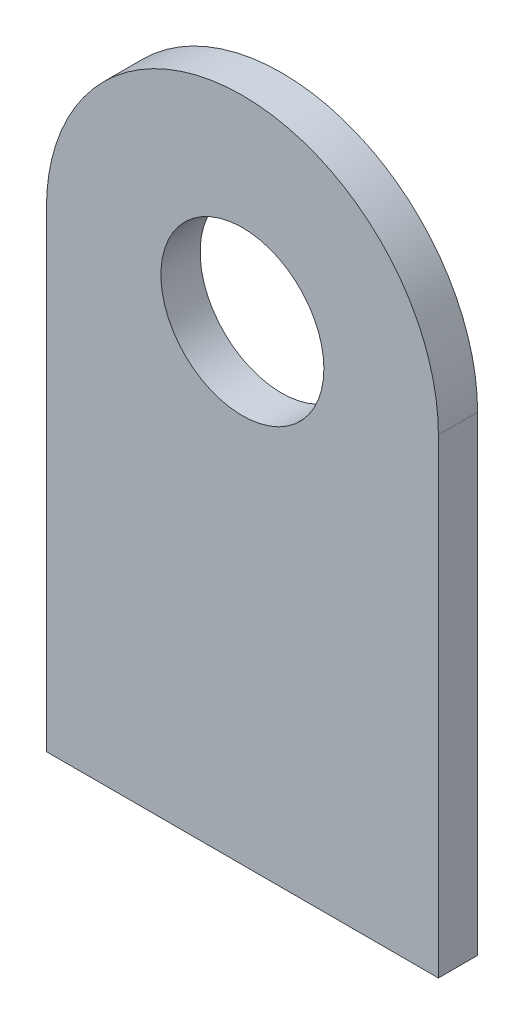
from build123d import *

# Parameters (mm, degrees)
BOSS_EXTRUDE1_DEPTH  = 1.5875
M6_CLEARANCE_HOLE1_D = 6.6
SKETCH5_W            = 15.875
SKETCH5_H            = 6.35
CUT_EXTRUDE2_DEPTH   = 27.658658303


with BuildPart() as part:
    # Sketch1 → Boss-Extrude1 (new body)
    with BuildSketch(Plane.XY):
        with BuildLine():
            Line((7.9375, -25.4), (7.9375, 0))
            ThreePointArc((7.9375, 0), (0, 7.9375), (-7.9375, 0))
            Line((-7.9375, 0), (-7.9375, -25.4))
            Line((-7.9375, -25.4), (7.9375, -25.4))
        make_face()
    extrude(amount=BOSS_EXTRUDE1_DEPTH)

    # M6 Clearance Hole1 (through all)
    with Locations(Plane.XY.offset(1.5875)):
        with Locations((0, 0)):
            Hole(M6_CLEARANCE_HOLE1_D / 2)

    # Sketch5 → Cut-Extrude2 (cut, through all)
    with BuildSketch(Plane.XY.offset(1.5875)):
        with Locations((0, -22.225)):
            Rectangle(SKETCH5_W, SKETCH5_H)
    extrude(amount=-CUT_EXTRUDE2_DEPTH, mode=Mode.SUBTRACT)


solid = part.part
